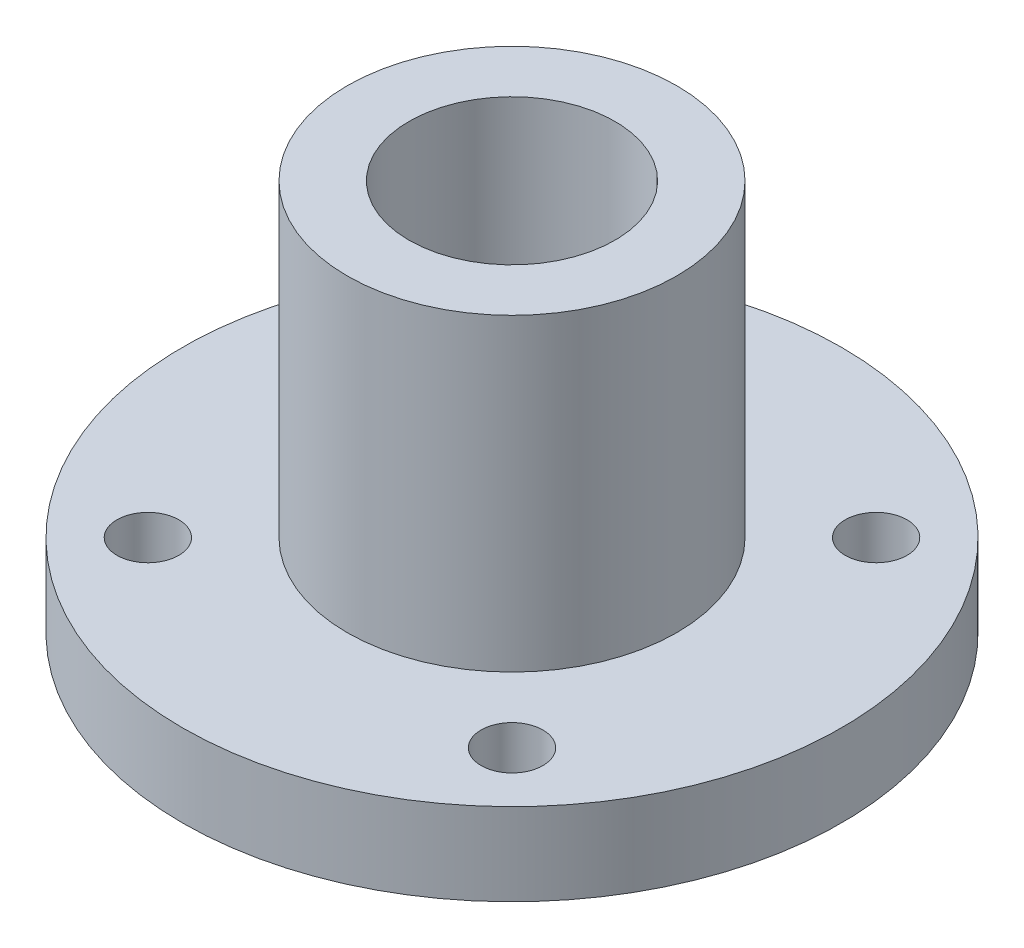
from build123d import *

# Parameters (mm, degrees)
SKETCH1_R           = 16
SKETCH1_R_2         = 1.5
SKETCH1_R_3         = 5
BOSS_EXTRUDE1_DEPTH = 4
SKETCH2_R           = 8
SKETCH2_R_2         = 5
BOSS_EXTRUDE2_DEPTH = 15


with BuildPart() as part:
    # Sketch1 → Boss-Extrude1 (new body)
    with BuildSketch(Plane(origin=(0, 0, 0), x_dir=(1, 0, 0), z_dir=(0, 1, 0))):
        Circle(SKETCH1_R)
        with Locations((8.838834765, -8.838834765)):
            Circle(SKETCH1_R_2, mode=Mode.SUBTRACT)
        Circle(SKETCH1_R_3, mode=Mode.SUBTRACT)
        with Locations((-8.838834765, -8.838834765)):
            Circle(SKETCH1_R_2, mode=Mode.SUBTRACT)
        with Locations((8.838834765, 8.838834765)):
            Circle(SKETCH1_R_2, mode=Mode.SUBTRACT)
        with Locations((-8.838834765, 8.838834765)):
            Circle(SKETCH1_R_2, mode=Mode.SUBTRACT)
    extrude(amount=BOSS_EXTRUDE1_DEPTH)

    # Sketch2 → Boss-Extrude2 (add)
    with BuildSketch(Plane(origin=(0, 4, 0), x_dir=(1, 0, 0), z_dir=(0, 1, 0))):
        Circle(SKETCH2_R)
        Circle(SKETCH2_R_2, mode=Mode.SUBTRACT)
    extrude(amount=BOSS_EXTRUDE2_DEPTH)


solid = part.part
